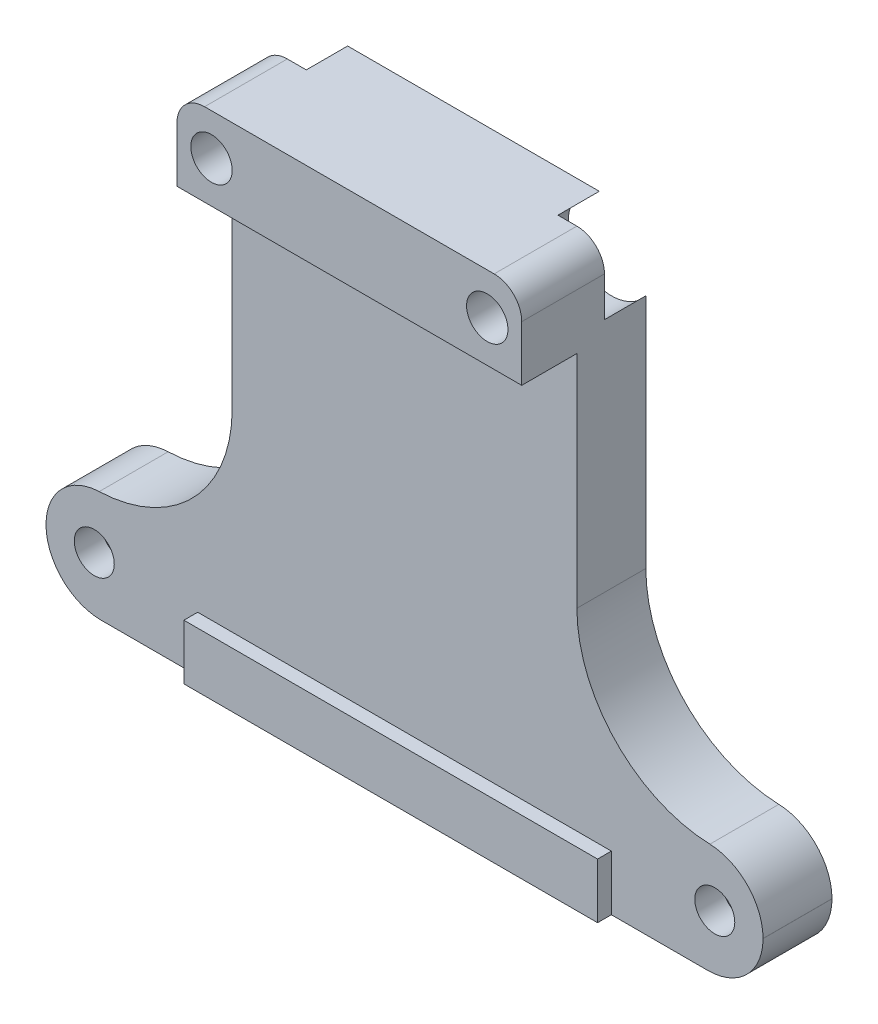
from build123d import *

# Parameters (mm, degrees)
SKETCH_1_W          = 52
SKETCH_1_H          = 8
SKETCH_1_R          = 1.45
EXTRUDE_1_DEPTH     = 5
SKETCH_2_W          = 25
SKETCH_2_H          = 32
SKETCH_2_R          = 1.5
EXTRUDE_2_DEPTH     = 5
SKETCH_3_W          = 25
SKETCH_3_H          = 6
SKETCH_3_R          = 1.5
EXTRUDE_3_DEPTH     = 4
FILLET_1_R          = 10
FILLET_2_R          = 4
FILLET_3_R          = 2
SKETCH_4_R          = 3.125
CUT_EXTRUDE_3_DEPTH = 3
SKETCH_5_W          = 30
SKETCH_5_H          = 4
EXTRUDE_4_DEPTH     = 1


with BuildPart() as part:
    # Эскиз1 → Бобышка-Вытянуть1 (new body)
    with BuildSketch(Plane.XY):
        Rectangle(SKETCH_1_W, SKETCH_1_H)
        with Locations((-22.5, 0)):
            Circle(SKETCH_1_R, mode=Mode.SUBTRACT)
        with Locations((22.5, 0)):
            Circle(SKETCH_1_R, mode=Mode.SUBTRACT)
    extrude(amount=EXTRUDE_1_DEPTH)

    # Эскиз2 → Бобышка-Вытянуть2 (add)
    with BuildSketch(Plane(origin=(0, 0, 0), x_dir=(-1, 0, 0), z_dir=(0, 0, -1))):
        with Locations((0, 20)):
            Rectangle(SKETCH_2_W, SKETCH_2_H)
        with Locations((-10, 33)):
            Circle(SKETCH_2_R, mode=Mode.SUBTRACT)
        with Locations((10, 33)):
            Circle(SKETCH_2_R, mode=Mode.SUBTRACT)
    extrude(amount=-EXTRUDE_2_DEPTH)

    # Эскиз3 → Бобышка-Вытянуть3 (add)
    with BuildSketch(Plane(origin=(0, 0, 5), x_dir=(-1, 0, 0), z_dir=(0, 0, -1))):
        with Locations((0, 33)):
            Rectangle(SKETCH_3_W, SKETCH_3_H)
        with Locations((10, 33)):
            Circle(SKETCH_3_R, mode=Mode.SUBTRACT)
        with Locations((-10, 33)):
            Circle(SKETCH_3_R, mode=Mode.SUBTRACT)
    extrude(amount=-EXTRUDE_3_DEPTH)

    # Скругление1
    fillet_1_edges = [part.edges().sort_by_distance(p)[0] for p in [
        (12.5, 4, 2.5),
        (-12.5, 4, 2.5),
    ]]
    fillet(fillet_1_edges, radius=FILLET_1_R)

    # Скругление2
    fillet_2_edges = [part.edges().sort_by_distance(p)[0] for p in [
        (-26, -4, 2.5),
        (-26, 4, 2.5),
        (26, -4, 2.5),
        (26, 4, 2.5),
    ]]
    fillet(fillet_2_edges, radius=FILLET_2_R)

    # Скругление3
    fillet_3_edges = [part.edges().sort_by_distance(p)[0] for p in [
        (12.5, 36, 4.5),
        (-12.5, 36, 4.5),
    ]]
    fillet(fillet_3_edges, radius=FILLET_3_R)

    # Эскиз4 → Вырез-Вытянуть3 (cut)
    with BuildSketch(Plane(origin=(0, 0, 0), x_dir=(-1, 0, 0), z_dir=(0, 0, -1))):
        with Locations((-10, 33)):
            Circle(SKETCH_4_R)
        with Locations((10, 33)):
            Circle(SKETCH_4_R)
        with Locations((-22.5, 0)):
            Circle(SKETCH_4_R)
        with Locations((22.5, 0)):
            Circle(SKETCH_4_R)
    extrude(amount=-CUT_EXTRUDE_3_DEPTH, mode=Mode.SUBTRACT)

    # Эскиз5 → Бобышка-Вытянуть4 (add)
    with BuildSketch(Plane.XY.offset(5)):
        with Locations((0, -2)):
            Rectangle(SKETCH_5_W, SKETCH_5_H)
    extrude(amount=EXTRUDE_4_DEPTH)


solid = part.part
